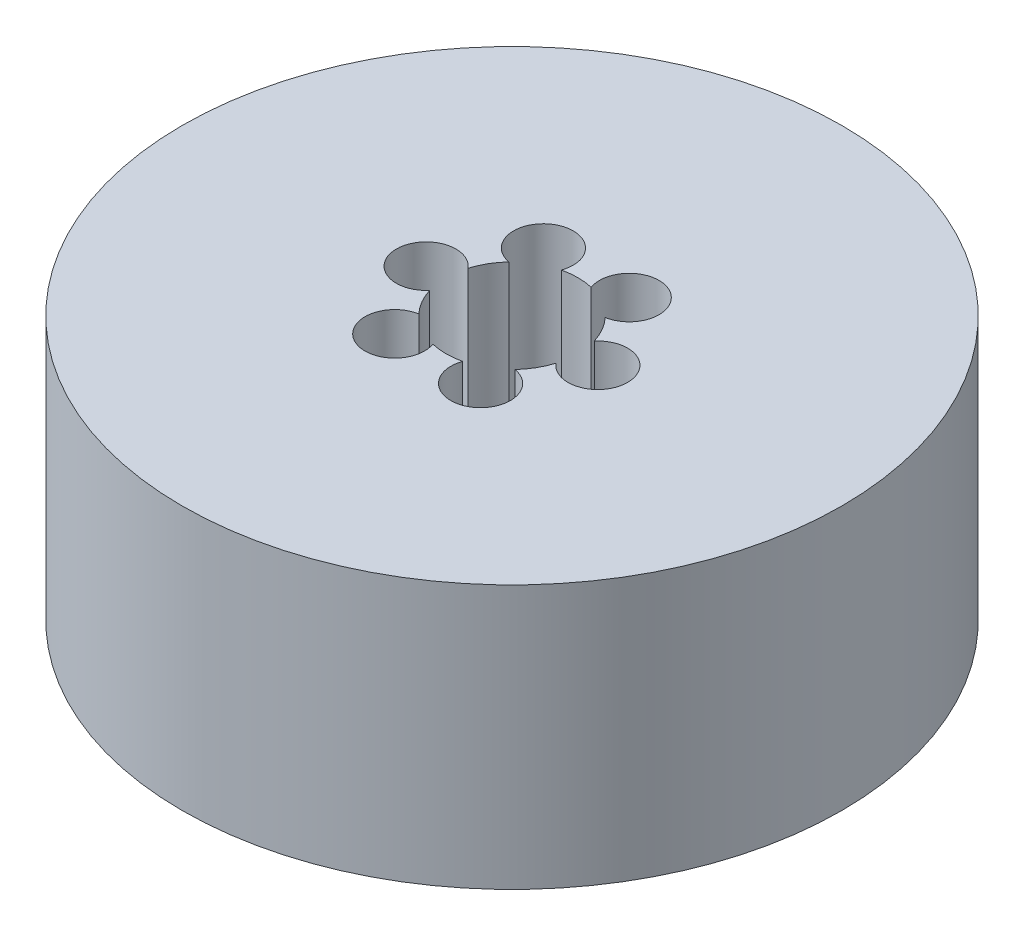
from build123d import *

# Parameters (mm, degrees)
SKETCH1_R           = 25
BOSS_EXTRUDE1_DEPTH = 20
SKETCH2_R           = 5
CUT_EXTRUDE1_DEPTH  = 41.620192023
SKETCH3_R           = 2.257789853
CUT_EXTRUDE2_DEPTH  = 14.172727946
CIRPATTERN1_COUNT   = 6


with BuildPart() as part:
    # Sketch1 → Boss-Extrude1 (new body)
    with BuildSketch(Plane(origin=(0, 0, 0), x_dir=(1, 0, 0), z_dir=(0, 1, 0))):
        Circle(SKETCH1_R)
    extrude(amount=BOSS_EXTRUDE1_DEPTH)

    # Sketch2 → Cut-Extrude1 (cut, through all)
    with BuildSketch(Plane(origin=(0, 0, 0), x_dir=(1, 0, 0), z_dir=(0, 1, 0))):
        Circle(SKETCH2_R)
    extrude(amount=CUT_EXTRUDE1_DEPTH, mode=Mode.SUBTRACT)

    # Sketch3 → Cut-Extrude2 (cut)
    with BuildSketch(Plane(origin=(0, 20, 0), x_dir=(1, 0, 0), z_dir=(0, 1, 0))):
        with Locations((-6.508770539, 0)):
            Circle(SKETCH3_R)
    cut_extrude2 = extrude(amount=-CUT_EXTRUDE2_DEPTH, mode=Mode.SUBTRACT)

    # CirPattern1: Cut-Extrude2 ×6 about axis
    cirpattern1_axis = Axis((0, 0, 0), (0, 1, 0))
    for i in range(1, CIRPATTERN1_COUNT):
        add(cut_extrude2.rotate(cirpattern1_axis, i * 360 / CIRPATTERN1_COUNT), mode=Mode.SUBTRACT)


solid = part.part
